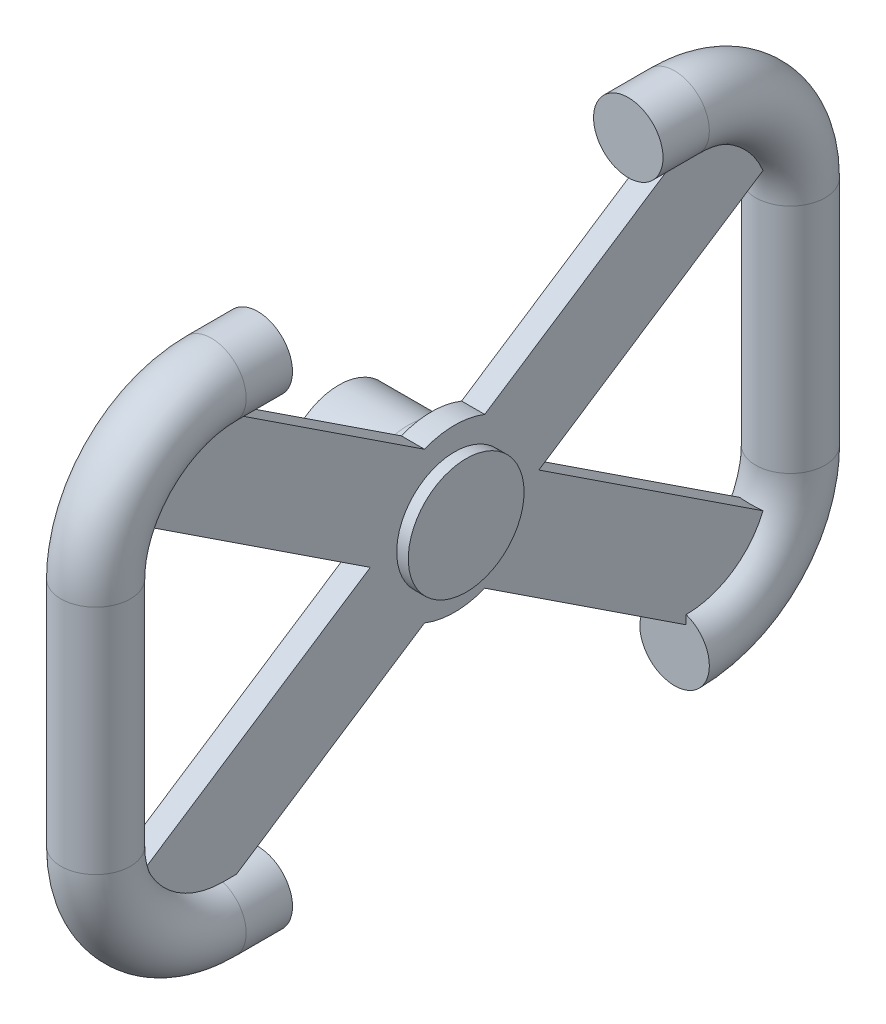
from build123d import *

# Parameters (mm, degrees)
SKETCH14_R          = 1.5
SKETCH15_R          = 1.5
CUT_EXTRUDE4_DEPTH  = 8
SKETCH16_R          = 1
BOSS_EXTRUDE4_DEPTH = 0.5
SKETCH17_R          = 2.5
BOSS_EXTRUDE5_DEPTH = 0.5
SKETCH18_R          = 2.5
SKETCH18_R_2        = 1
BOSS_EXTRUDE6_DEPTH = 4
FILLET2_R           = 1


with BuildPart() as part:
    # Sweep3: sweep along a path in Sketch12
    with BuildLine(Plane(origin=(0, 0, 0), x_dir=(0, 0, -1), z_dir=(1, 0, 0))) as sweep3_path:
        Line((0, 0), (-10, 0))
        ThreePointArc((-10, 0), (-13.535533906, 1.464466094), (-15, 5))
        Line((-15, 5), (-15, 15))
        ThreePointArc((-15, 15), (-13.535533906, 18.535533906), (-10, 20))
        Line((-10, 20), (10, 20))
        ThreePointArc((10, 20), (13.535533906, 18.535533906), (15, 15))
        Line((15, 15), (15, 5))
        ThreePointArc((15, 5), (13.535533906, 1.464466094), (10, 0))
    # Sketch14 → Sweep3 (sweep)
    with BuildSketch(Plane.XY):
        Circle(SKETCH14_R)
    sweep(path=sweep3_path.line)

    # Sketch15 → Cut-Extrude4 (cut, symmetric)
    with BuildSketch(Plane.XY):
        with Locations(Location((0, 0, 0), (0, 0, 270))):
            Circle(SKETCH15_R)
        with Locations((0, 20)):
            Circle(SKETCH15_R)
    extrude(amount=CUT_EXTRUDE4_DEPTH, both=True, mode=Mode.SUBTRACT)


with BuildPart() as cut_extrude4_piece_1:
    # of the separate pieces the step leaves, piece 1, a body of its own (cut_extrude4_pieces)
    add(part.part.solids().sort_by_distance((1.5, 0, 8))[0])



with BuildPart() as cut_extrude4_piece_2:
    # of the separate pieces the step leaves, piece 2, a body of its own (cut_extrude4_pieces)
    add(part.part.solids().sort_by_distance((1.5, 20, -8))[0])


with BuildPart() as cut_extrude4_piece_1_1:
    add(cut_extrude4_piece_1.part)

    add(cut_extrude4_piece_2.part)  # Boss-Extrude4 merges Cut-Extrude4 piece 2
    # Sketch16 → Boss-Extrude4 (add, symmetric)
    with BuildSketch(Plane(origin=(0, 0, 0), x_dir=(0, 0, -1), z_dir=(1, 0, 0))):
        with BuildLine():
            Line((1.301340093, 13.24907894), (11.406580041, 19.892717907))
            ThreePointArc((11.406580041, 19.892717907), (12.616460575, 18.294628285), (13.603996717, 16.550359466))
            Line((13.603996717, 16.550359466), (3.640638612, 10))
            Line((3.640638612, 10), (13.603996717, 3.449640534))
            ThreePointArc((13.603996717, 3.449640534), (12.616460575, 1.705371715), (11.406580041, 0.107282093))
            Line((11.406580041, 0.107282093), (1.301340093, 6.75092106))
            ThreePointArc((1.301340093, 6.75092106), (0, 6.5), (-1.301340093, 6.75092106))
            Line((-1.301340093, 6.75092106), (-11.406580041, 0.107282093))
            ThreePointArc((-11.406580041, 0.107282093), (-12.616460575, 1.705371715), (-13.603996717, 3.449640534))
            Line((-13.603996717, 3.449640534), (-3.640638612, 10))
            Line((-3.640638612, 10), (-13.603996717, 16.550359466))
            ThreePointArc((-13.603996717, 16.550359466), (-12.616460575, 18.294628285), (-11.406580041, 19.892717907))
            Line((-11.406580041, 19.892717907), (-1.301340093, 13.24907894))
            ThreePointArc((-1.301340093, 13.24907894), (0, 13.5), (1.301340093, 13.24907894))
        make_face()
        with Locations((0, 10)):
            Circle(SKETCH16_R, mode=Mode.SUBTRACT)
    extrude(amount=BOSS_EXTRUDE4_DEPTH, both=True)

    # Sketch17 → Boss-Extrude5 (add)
    with BuildSketch(Plane(origin=(0.5, 0, 0), x_dir=(0, 0, -1), z_dir=(1, 0, 0))):
        with Locations((0, 10)):
            Circle(SKETCH17_R)
    extrude(amount=BOSS_EXTRUDE5_DEPTH)

    # Sketch18 → Boss-Extrude6 (add)
    with BuildSketch(Plane.ZY.offset(0.5)):
        with Locations(Location((0, 10, 0), (0, 0, 180))):
            Circle(SKETCH18_R)
        with Locations((0, 10)):
            Circle(SKETCH18_R_2, mode=Mode.SUBTRACT)
    extrude(amount=BOSS_EXTRUDE6_DEPTH)

    # Fillet2
    fillet2_edges = [cut_extrude4_piece_1_1.edges().sort_by_distance(p)[0] for p in [
        (-0.5, 10, 2.5),
    ]]
    fillet(fillet2_edges, radius=FILLET2_R - 0.0001)  # a hair under: the kernel refuses the full size


solid = cut_extrude4_piece_1_1.part
